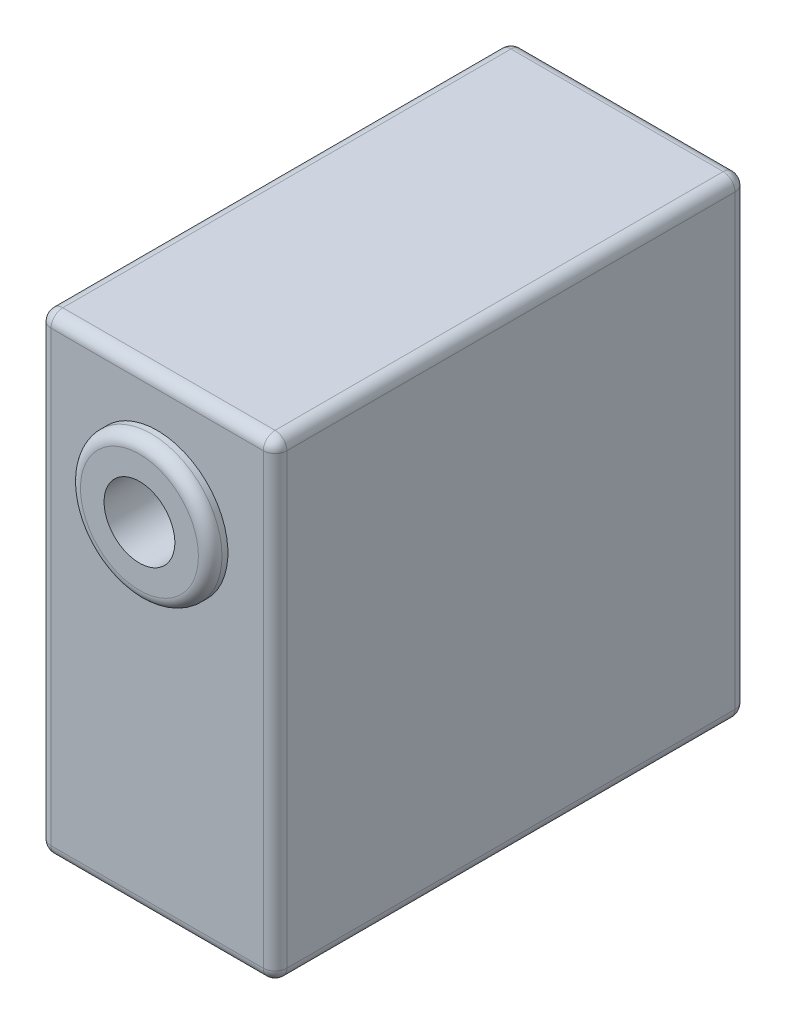
from build123d import *

# Parameters (mm, degrees)
SKETCH1_W               = 40
SKETCH1_H               = 40
BOSS_EXTRUDE1_DEPTH     = 20
FILLET1_R               = 1
SKETCH2_R               = 6
BOSS_EXTRUDE2_DEPTH     = 1.5
FILLET2_R               = 1
BOSS_EXTRUDE4_START     = 0.9
SKETCH4_R               = 6
BOSS_EXTRUDE4_DEPTH     = 0.9
FILLET3_R               = 1
CUT_EXTRUDE2_DEPTH      = 55.163169457
CUT_EXTRUDE2_DEPTH_BACK = 55.163169457
SKETCH3_R               = 3


with BuildPart() as part:
    # Sketch1 → Boss-Extrude1 (new body)
    with BuildSketch(Plane(origin=(0, 0, 0), x_dir=(0, 0, -1), z_dir=(1, 0, 0))):
        with Locations((6.618181818, -7.127272727)):
            Rectangle(SKETCH1_W, SKETCH1_H)
    extrude(amount=BOSS_EXTRUDE1_DEPTH)

    # Fillet1
    fillet1_edges = [part.edges().sort_by_distance(p)[0] for p in [
        (20, -7.127272727, -26.618181818),
        (20, 12.872727273, -6.618181818),
        (20, -7.127272727, 13.381818182),
        (0, 12.872727273, -6.618181818),
        (0, -7.127272727, -26.618181818),
        (0, -27.127272727, -6.618181818),
        (0, -7.127272727, 13.381818182),
        (20, -27.127272727, -6.618181818),
        (10, 12.872727273, 13.381818182),
        (10, 12.872727273, -26.618181818),
        (10, -27.127272727, -26.618181818),
        (10, -27.127272727, 13.381818182),
    ]]
    fillet(fillet1_edges, radius=FILLET1_R)

    # Sketch2 → Boss-Extrude2 (add)
    with BuildSketch(Plane.XY.offset(13.381818182)):
        with Locations(Location((10, 2.872727273, 0), (0, 0, 180))):
            Circle(SKETCH2_R)
    extrude(amount=BOSS_EXTRUDE2_DEPTH)

    # Fillet2
    fillet2_edges = [part.edges().sort_by_distance(p)[0] for p in [
        (16, 2.872727273, 14.881818182),
    ]]
    fillet(fillet2_edges, radius=FILLET2_R)

    # Sketch4 → Boss-Extrude4 (add)
    with BuildSketch(Plane(origin=(0, 0, -26.618181818), x_dir=(-1, 0, 0), z_dir=(0, 0, -1)).offset(BOSS_EXTRUDE4_START)):
        with Locations((-10, 2.872727273)):
            Circle(SKETCH4_R)
    extrude(amount=-BOSS_EXTRUDE4_DEPTH)

    # Fillet3
    # the kernel refuses this fillet: 1 mm, written as the material it takes off along each edge
    with BuildSketch(Plane(origin=(10, 2.872727273, -27.518181818), x_dir=(-1, 0, 0), z_dir=(0, -1, 0))) as fillet3_piece_1:
        with BuildLine():
            CenterArc((5.005012563, -1), FILLET3_R, 5.739170477, 84.260829523)
            Line((5.005012563, 0), (5.005012563, 0.02))
            Line((5.005012563, 0.02), (6, 0.02))
            Line((6, 0.02), (6.02, 0))
            ThreePointArc((6.02, 0), (6.02, -0.45), (6.019899749, -0.898))
            Line((6.019899749, -0.898), (6, -0.9))
        make_face()
    revolve(axis=Axis((10, 2.872727273, -27.518181818), (0, 0, -1)), mode=Mode.SUBTRACT)

    # Sketch3 → Cut-Extrude2 (cut, two sides: drawn at the far end of the back side and taken through both)
    with BuildSketch(Plane.XY.offset(14.881818182).offset(-CUT_EXTRUDE2_DEPTH_BACK)):
        with Locations(Location((10, 2.872727273, 0), (0, 0, 180))):
            Circle(SKETCH3_R)
    extrude(amount=CUT_EXTRUDE2_DEPTH + CUT_EXTRUDE2_DEPTH_BACK, mode=Mode.SUBTRACT)


solid = part.part
